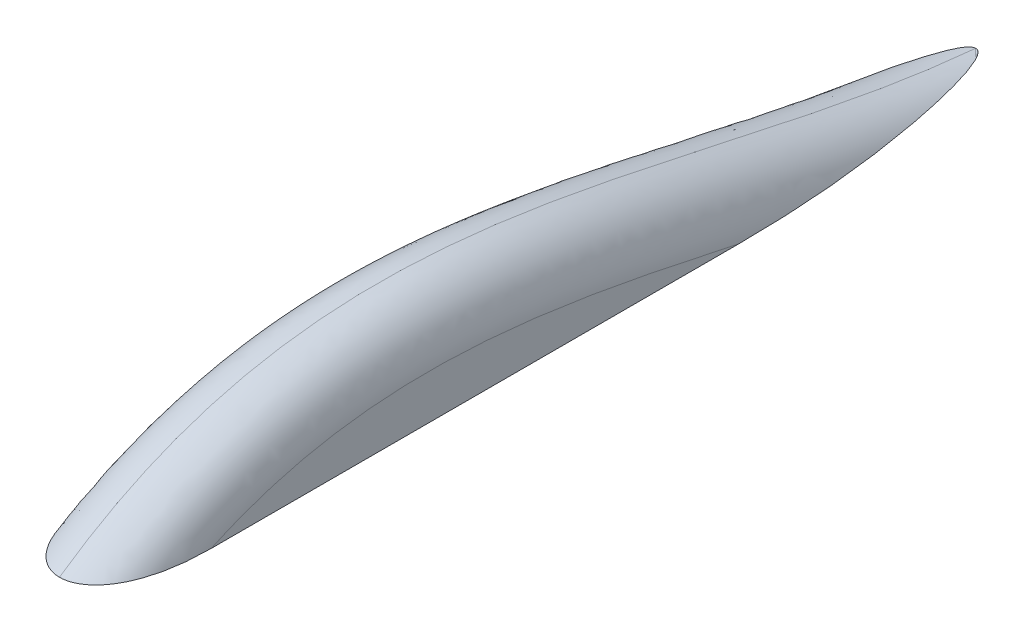
from build123d import *

# Parameters (mm, degrees)
BOSS_EXTRUDE1_DEPTH = 10
FILLET1_R           = 5


with BuildPart() as part:
    # Sketch1 → Boss-Extrude1 (new body)
    with BuildSketch(Plane(origin=(0, 0, 0), x_dir=(0, 0, -1), z_dir=(1, 0, 0))):
        with BuildLine():
            Line((-43.25, 0), (46.75, 0))
            add(Edge.make_bspline(
                [(-43.25, 0), (-15.250046728, 19.700173134), (16.877274504, 2.689385841), (46.75, 0)],
                knots=[0, 0, 0, 0, 1, 1, 1, 1], degree=3))
        make_face()
    extrude(amount=BOSS_EXTRUDE1_DEPTH)

    # Fillet1
    fillet1_edges = [part.edges().sort_by_distance(p)[0] for p in [
        (0, 8.396084616, -1.047710416),
        (10, 8.396084616, -1.047710416),
    ]]
    fillet(fillet1_edges, radius=FILLET1_R - 0.0001)  # a hair under: the kernel refuses the full size


solid = part.part
